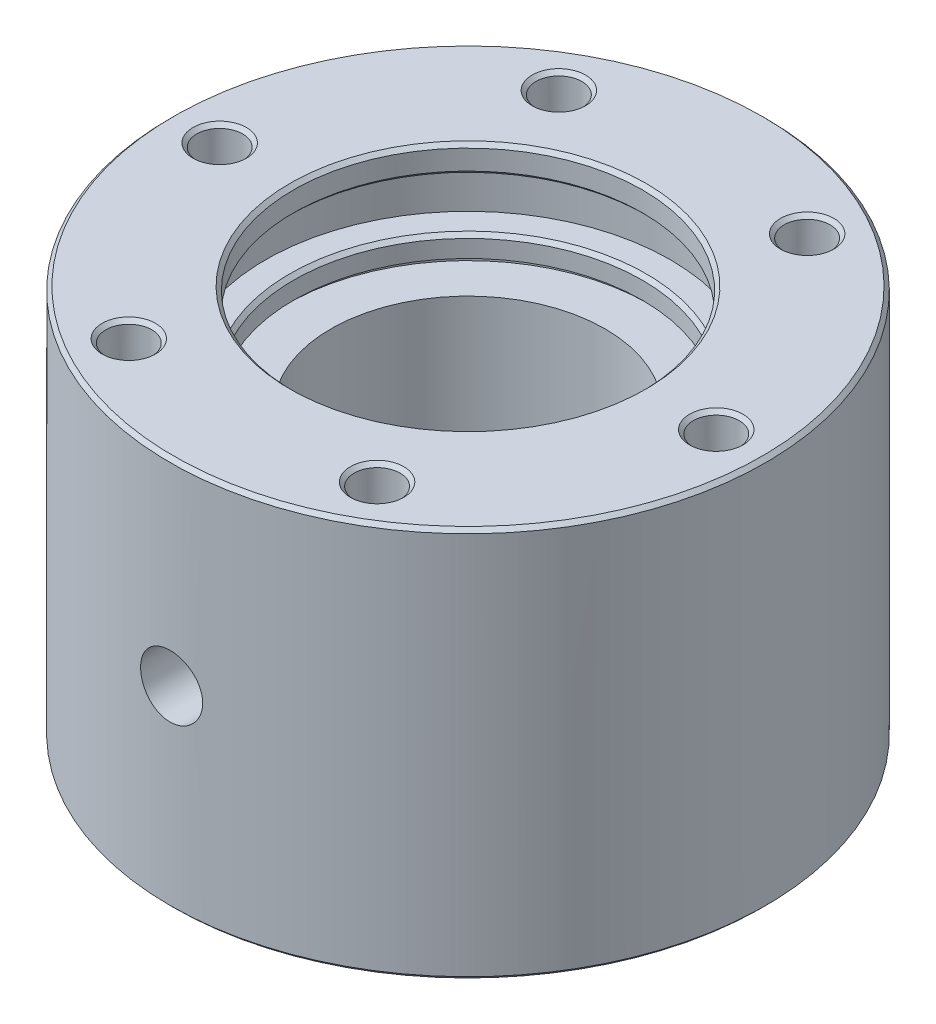
from build123d import *

# Parameters (mm, degrees)
SKETCH5_R              = 1.85
CUT_EXTRUDE2_DEPTH     = 6
CUT_EXTRUDE3_START     = -6
SKETCH8_R              = 1.85
CUT_EXTRUDE3_DEPTH     = 6
CHAMFER1_SIZE          = 0.3
CUT_EXTRUDE4_START     = 10.763479818
CUT_EXTRUDE4_OUTLINE_R = 2.5
CUT_EXTRUDE4_DEPTH     = 13.236520282


# Read off the part's stored shape, not the designer's step: Cut-Extrude4
with BuildPart() as part:
    # Sketch1 → Revolve1 (revolve)
    with BuildSketch(Plane.XY, mode=Mode.PRIVATE) as revolve1_sk:
        Polygon((-14.05, 0), (-24, 0), (-24, 31.5), (-14.05, 31.5), (-14.05, 29.3), (-16.3, 29.3), (-16.3, 25.2), (-14.05, 25.2), (-14.05, 23.5), (-14.55, 23.5), (-14.55, 23), (-14.05, 23), (-11.05, 23), (-11.05, 8.5), (-14.05, 8.5), (-14.55, 8.5), (-14.55, 8), (-14.05, 8), (-14.05, 6.3), (-16.3, 6.3), (-16.3, 2.2), (-14.05, 2.2), align=None)
    revolve(revolve1_sk.sketch.rotate(Axis((0, 0, 0), (0, 1, 0)), 270), axis=Axis((0, 0, 0), (0, 1, 0)))

    # Sketch5 → Cut-Extrude2 (cut)
    with BuildSketch(Plane(origin=(0, 31.5, 0), x_dir=(1, 0, 0), z_dir=(0, 1, 0))):
        with Locations(Location((-20, 0, 0), (0, 0, 270))):
            Circle(SKETCH5_R)
        with Locations(Location((-10, 17.320508076, 0), (0, 0, 270))):
            Circle(SKETCH5_R)
        with Locations(Location((10, 17.320508076, 0), (0, 0, 270))):
            Circle(SKETCH5_R)
        with Locations(Location((20, 0, 0), (0, 0, 270))):
            Circle(SKETCH5_R)
        with Locations(Location((10, -17.320508076, 0), (0, 0, 270))):
            Circle(SKETCH5_R)
        with Locations(Location((-10, -17.320508076, 0), (0, 0, 270))):
            Circle(SKETCH5_R)
    extrude(amount=-CUT_EXTRUDE2_DEPTH, mode=Mode.SUBTRACT)

    # Sketch8 → Cut-Extrude3 (cut)
    with BuildSketch(Plane.XZ.offset(CUT_EXTRUDE3_START)):
        with Locations(Location((-20, 0, 0), (0, 0, 90))):
            Circle(SKETCH8_R)
        with Locations(Location((-10, 17.320508076, 0), (0, 0, 90))):
            Circle(SKETCH8_R)
        with Locations(Location((10, 17.320508076, 0), (0, 0, 90))):
            Circle(SKETCH8_R)
        with Locations(Location((20, 0, 0), (0, 0, 90))):
            Circle(SKETCH8_R)
        with Locations(Location((10, -17.320508076, 0), (0, 0, 90))):
            Circle(SKETCH8_R)
        with Locations(Location((-10, -17.320508076, 0), (0, 0, 90))):
            Circle(SKETCH8_R)
    extrude(amount=CUT_EXTRUDE3_DEPTH, mode=Mode.SUBTRACT)

    # Chamfer1
    chamfer1_edges = [part.edges().sort_by_distance(p)[0] for p in [
        (0, 2.2, 14.05),
        (0, 0, 24),
        (0, 31.5, 24),
        (0, 31.5, 14.05),
        (0, 29.3, 14.05),
        (0, 25.2, 14.05),
        (-20, 31.5, -1.85),
        (-10, 31.5, 15.470508076),
        (10, 31.5, 15.470508076),
        (20, 31.5, -1.85),
        (10, 31.5, -19.170508076),
        (-10, 31.5, -19.170508076),
        (-20, 0, -1.85),
        (-10, 0, -19.170508076),
        (10, 0, -19.170508076),
        (20, 0, -1.85),
        (10, 0, 15.470508076),
        (-10, 0, 15.470508076),
    ]]
    chamfer(chamfer1_edges, length=CHAMFER1_SIZE)

    # Cut-Extrude4 outline → Cut-Extrude4 (cut)
    with BuildSketch(Plane.XY.offset(CUT_EXTRUDE4_START)):
        with Locations((0, 15.6)):
            Circle(CUT_EXTRUDE4_OUTLINE_R)
    extrude(amount=CUT_EXTRUDE4_DEPTH, mode=Mode.SUBTRACT)


solid = part.part
